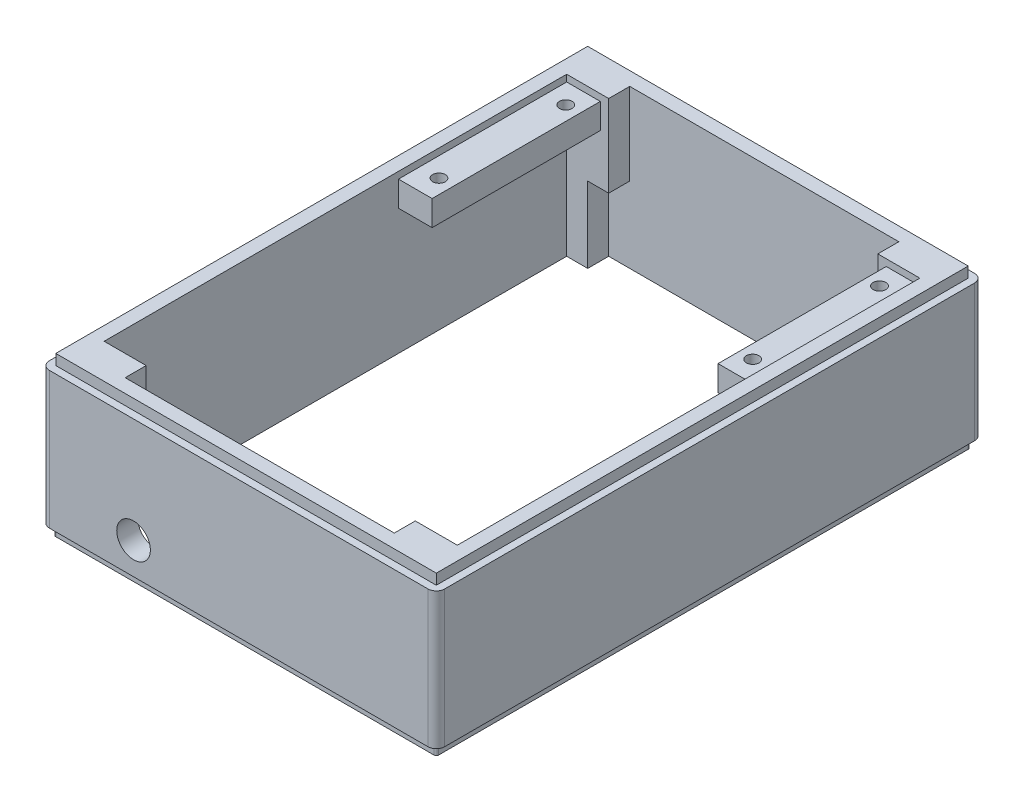
from build123d import *

# Parameters (mm, degrees)
SKETCH1_W                    = 94
SKETCH1_H                    = 130
BOSS_EXTRUDE1_DEPTH          = 35
SKETCH2_W                    = 90.5
SKETCH2_H                    = 126.5
BOSS_EXTRUDE2_DEPTH          = 2.5
CUT_EXTRUDE1_DEPTH           = 165.749051591
SKETCH4_W                    = 5
SKETCH4_H                    = 18
CUT_EXTRUDE2_DEPTH           = 5
SKETCH9_W                    = 5
SKETCH9_H                    = 18
CUT_EXTRUDE6_DEPTH           = 5
SKETCH11_W                   = 5
SKETCH11_H                   = 5
CUT_EXTRUDE8_DEPTH           = 18
SKETCH12_W                   = 5
SKETCH12_H                   = 18
CUT_EXTRUDE9_DEPTH           = 5
F_8_0_8_DIAMETER_HOLE1_D     = 8
F_8_0_8_DIAMETER_HOLE1_DEPTH = 5
FILLET1_R                    = 2
CUT_EXTRUDE10_START          = -2.5
CUT_EXTRUDE10_DEPTH          = 2.5
SKETCH17_W                   = 40
SKETCH17_H                   = 6
BOSS_EXTRUDE3_DEPTH          = 8
SKETCH18_W                   = 40
SKETCH18_H                   = 6
BOSS_EXTRUDE4_DEPTH          = 8
SKETCH23_R                   = 1.5
CUT_EXTRUDE11_DEPTH          = 4.4


with BuildPart() as part:
    # Sketch1 → Boss-Extrude1 (new body)
    with BuildSketch(Plane.XZ):
        with Locations((47, -65)):
            Rectangle(SKETCH1_W, SKETCH1_H)
    extrude(amount=-BOSS_EXTRUDE1_DEPTH)

    # Sketch2 → Boss-Extrude2 (add)
    with BuildSketch(Plane(origin=(0, 35, 0), x_dir=(-1, 0, 0), z_dir=(0, 1, 0))):
        with Locations((-47, -65)):
            Rectangle(SKETCH2_W, SKETCH2_H)
    extrude(amount=BOSS_EXTRUDE2_DEPTH)

    # Sketch3 → Cut-Extrude1 (cut, through all)
    with BuildSketch(Plane(origin=(0, 37.5, 0), x_dir=(-1, 0, 0), z_dir=(0, 1, 0))):
        Polygon((-83, -120), (-79, -120), (-79, -125), (-15, -125), (-15, -120), (-5, -120), (-5, -10), (-15, -10), (-15, -5), (-79, -5), (-79, -10), (-89, -10), (-89, -96), (-89, -120), align=None)
    extrude(amount=-CUT_EXTRUDE1_DEPTH, mode=Mode.SUBTRACT)

    # Sketch4 → Cut-Extrude2 (cut)
    with BuildSketch(Plane(origin=(0, 0, -10), x_dir=(-1, 0, 0), z_dir=(0, 0, -1))):
        with Locations((-12.5, 9)):
            Rectangle(SKETCH4_W, SKETCH4_H)
    extrude(amount=-CUT_EXTRUDE2_DEPTH, mode=Mode.SUBTRACT)

    # Sketch9 → Cut-Extrude6 (cut)
    with BuildSketch(Plane(origin=(0, 0, -10), x_dir=(-1, 0, 0), z_dir=(0, 0, -1))):
        with Locations((-81.5, 9)):
            Rectangle(SKETCH9_W, SKETCH9_H)
    extrude(amount=-CUT_EXTRUDE6_DEPTH, mode=Mode.SUBTRACT)

    # Sketch11 → Cut-Extrude8 (cut)
    with BuildSketch(Plane.XZ):
        with Locations((12.5, -122.5)):
            Rectangle(SKETCH11_W, SKETCH11_H)
    extrude(amount=-CUT_EXTRUDE8_DEPTH, mode=Mode.SUBTRACT)

    # Sketch12 → Cut-Extrude9 (cut)
    with BuildSketch(Plane.XY.offset(-120)):
        with Locations((81.5, 9)):
            Rectangle(SKETCH12_W, SKETCH12_H)
    extrude(amount=-CUT_EXTRUDE9_DEPTH, mode=Mode.SUBTRACT)

    # Ø8.0 (8) Diameter Hole1
    with Locations(Plane(origin=(0, 0, -5), x_dir=(-1, 0, 0), z_dir=(0, 0, -1))):
        with Locations((-22, 10)):
            Hole(F_8_0_8_DIAMETER_HOLE1_D / 2, depth=F_8_0_8_DIAMETER_HOLE1_DEPTH)

    # Fillet1
    fillet1_edges = [part.edges().sort_by_distance(p)[0] for p in [
        (0, 17.5, -130),
        (94, 17.5, -130),
        (0, 17.5, 0),
        (94, 17.5, 0),
    ]]
    fillet(fillet1_edges, radius=FILLET1_R)

    # Sketch16 → Cut-Extrude10 (cut)
    with BuildSketch(Plane.XZ.offset(CUT_EXTRUDE10_START)):
        with BuildLine():
            Line((0, -2), (0, -128))
            ThreePointArc((0, -128), (0.585786438, -129.414213562), (2, -130))
            Line((2, -130), (92, -130))
            ThreePointArc((92, -130), (93.414213562, -129.414213562), (94, -128))
            Line((94, -128), (94, -2))
            ThreePointArc((94, -2), (93.414213562, -0.585786438), (92, 0))
            Line((92, 0), (2, 0))
            ThreePointArc((2, 0), (0.585786438, -0.585786438), (0, -2))
        make_face()
        with BuildLine():
            Line((1.5, -2), (1.5, -128))
            ThreePointArc((1.5, -128), (1.646446609, -128.353553391), (2, -128.5))
            Line((2, -128.5), (92, -128.5))
            ThreePointArc((92, -128.5), (92.353553391, -128.353553391), (92.5, -128))
            Line((92.5, -128), (92.5, -2))
            ThreePointArc((92.5, -2), (92.353553391, -1.646446609), (92, -1.5))
            Line((92, -1.5), (2, -1.5))
            ThreePointArc((2, -1.5), (1.646446609, -1.646446609), (1.5, -2))
        make_face(mode=Mode.SUBTRACT)
    extrude(amount=CUT_EXTRUDE10_DEPTH, mode=Mode.SUBTRACT)

    # Sketch17 → Boss-Extrude3 (add)
    with BuildSketch(Plane(origin=(5, 0, 0), x_dir=(0, 0, -1), z_dir=(1, 0, 0))):
        with Locations((100, 32.9)):
            Rectangle(SKETCH17_W, SKETCH17_H)
    extrude(amount=BOSS_EXTRUDE3_DEPTH)

    # Sketch18 → Boss-Extrude4 (add)
    with BuildSketch(Plane.ZY.offset(-89)):
        with Locations((-100, 32.9)):
            Rectangle(SKETCH18_W, SKETCH18_H)
    extrude(amount=BOSS_EXTRUDE4_DEPTH)

    # Sketch23 → Cut-Extrude11 (cut)
    with BuildSketch(Plane(origin=(0, 35.9, 0), x_dir=(1, 0, 0), z_dir=(0, 1, 0))):
        with Locations((9.61875, 115.175)):
            Circle(SKETCH23_R)
        with Locations((9.61875, 85.0125)):
            Circle(SKETCH23_R)
        with Locations((84.23125, 115.175)):
            Circle(SKETCH23_R)
        with Locations((84.23125, 85.0125)):
            Circle(SKETCH23_R)
    extrude(amount=-CUT_EXTRUDE11_DEPTH, mode=Mode.SUBTRACT)


solid = part.part
